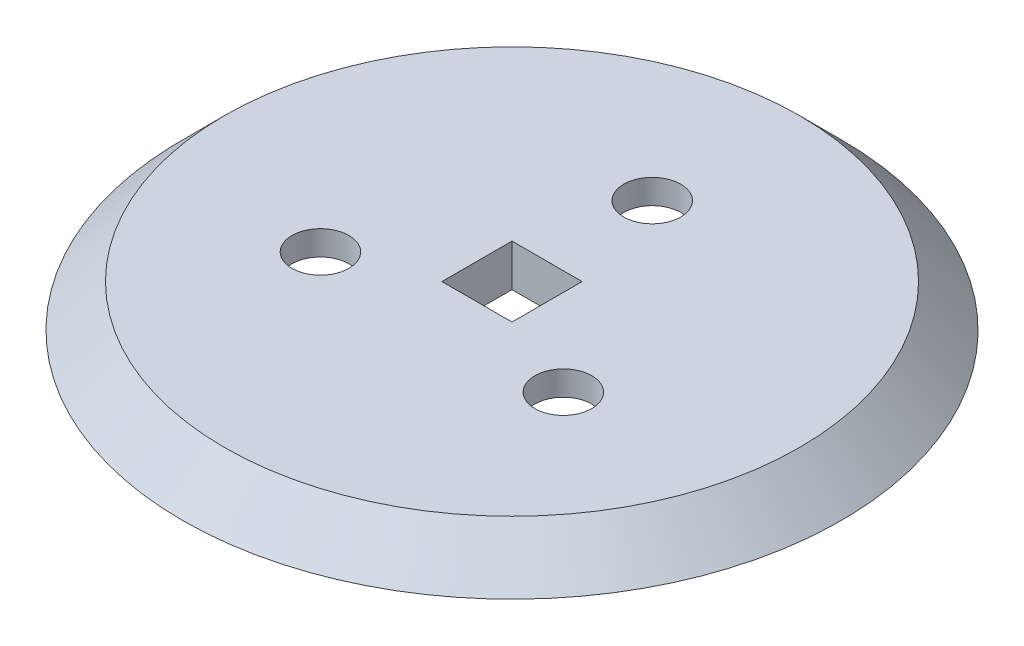
from build123d import *

# Parameters (mm, degrees)
SKETCH1_R           = 31.75
SKETCH1_R_2         = 2.5796875
SKETCH1_W           = 6.35
SKETCH1_H           = 6.35
BOSS_EXTRUDE1_DEPTH = 3.81
CHAMFER1_SIZE       = 5.715
SKETCH2_R           = 5.409375008
CUT_EXTRUDE1_DEPTH  = 1.5875


with BuildPart() as part:
    # Sketch1 → Boss-Extrude1 (new body)
    with BuildSketch(Plane(origin=(0, 0, 0), x_dir=(1, 0, 0), z_dir=(0, 1, 0))):
        with Locations(Location((0, 0, 0), (0, 0, 90))):
            Circle(SKETCH1_R)
        with Locations(Location((0, 12.7, 0), (0, 0, 90))):
            Circle(SKETCH1_R_2, mode=Mode.SUBTRACT)
        with Locations(Location((10.998522628, -6.35, 0), (0, 0, 90))):
            Circle(SKETCH1_R_2, mode=Mode.SUBTRACT)
        with Locations(Location((-10.998522628, -6.35, 0), (0, 0, 90))):
            Circle(SKETCH1_R_2, mode=Mode.SUBTRACT)
        Rectangle(SKETCH1_W, SKETCH1_H, mode=Mode.SUBTRACT)
    extrude(amount=BOSS_EXTRUDE1_DEPTH)

    # Chamfer1
    # the kernel refuses this chamfer: 5.715 mm, written as the material it takes off along each edge
    with BuildSketch(Plane(origin=(0, 3.81, 0), x_dir=(0, 0, -1), z_dir=(1, 0, 0))) as chamfer1_piece_1:
        Polygon((31.75, -CHAMFER1_SIZE), (31.75 - CHAMFER1_SIZE, 0), (31.75, 0), align=None)
    revolve(axis=Axis((0, 3.81, 0), (0, 1, 0)), mode=Mode.SUBTRACT)

    # Sketch2 → Cut-Extrude1 (cut)
    with BuildSketch(Plane(origin=(0, 0, 0), x_dir=(-1, 0, 0), z_dir=(0, -1, 0))):
        with Locations(Location((0, 12.7, 0), (0, 0, 90))):
            Circle(SKETCH2_R)
        with Locations(Location((10.998522628, -6.35, 0), (0, 0, 90))):
            Circle(SKETCH2_R)
        with Locations(Location((-10.998522628, -6.35, 0), (0, 0, 90))):
            Circle(SKETCH2_R)
    extrude(amount=-CUT_EXTRUDE1_DEPTH, mode=Mode.SUBTRACT)


solid = part.part
